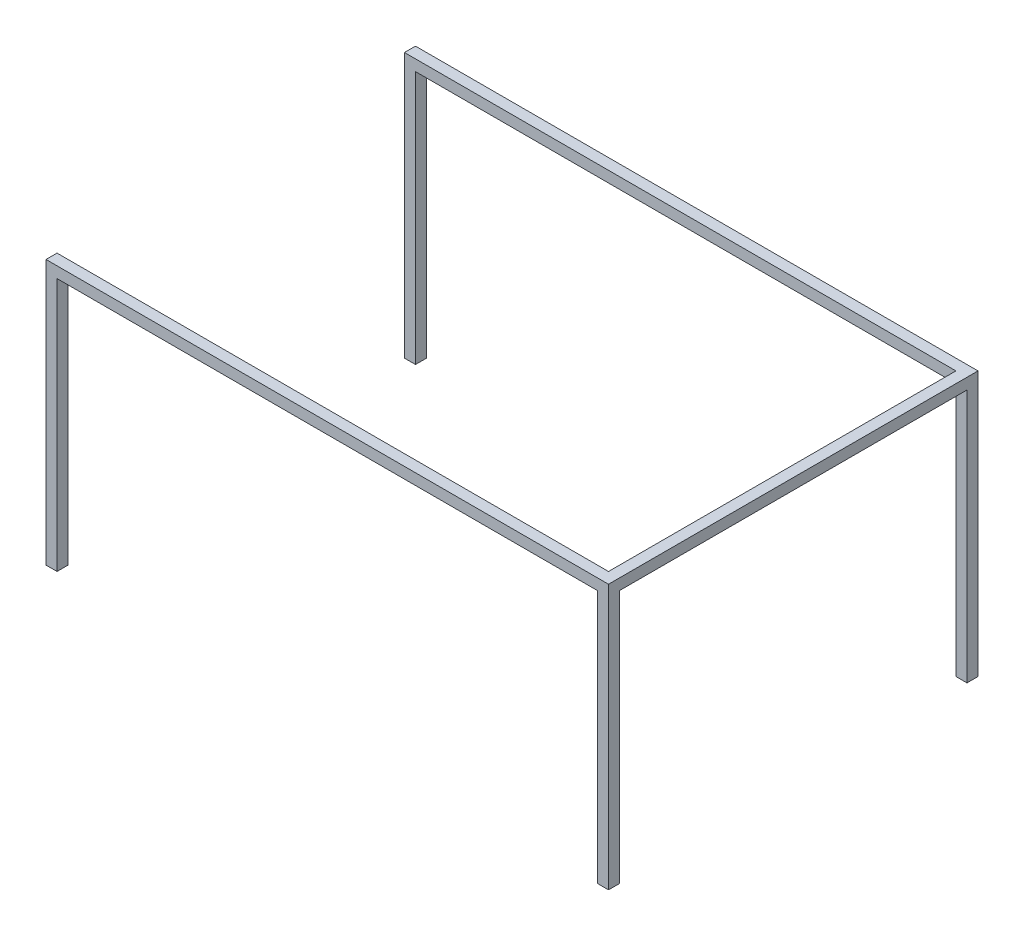
from build123d import *

# Parameters (mm, degrees)
BOSS_EXTRUDE1_DEPTH = 25.4
SKETCH2_W           = 25.4
SKETCH2_H           = 25.4
BOSS_EXTRUDE2_DEPTH = 584.2


with BuildPart() as part:
    # Sketch1 → Boss-Extrude1 (new body)
    with BuildSketch(Plane(origin=(0, 0, 0), x_dir=(1, 0, 0), z_dir=(0, 1, 0))):
        Polygon((-520.7, -425.45), (774.7, -425.45), (774.7, 425.45), (-520.7, 425.45), (-520.7, 400.05), (749.3, 400.05), (749.3, -400.05), (-520.7, -400.05), align=None)
    extrude(amount=BOSS_EXTRUDE1_DEPTH)

    # Sketch2 → Boss-Extrude2 (add)
    with BuildSketch(Plane(origin=(0, 0, 0), x_dir=(1, 0, 0), z_dir=(0, 1, 0))):
        with Locations((-508, 412.75)):
            Rectangle(SKETCH2_W, SKETCH2_H)
        with Locations((762, 412.75)):
            Rectangle(SKETCH2_W, SKETCH2_H)
        with Locations((762, -412.75)):
            Rectangle(SKETCH2_W, SKETCH2_H)
        with Locations((-508, -412.75)):
            Rectangle(SKETCH2_W, SKETCH2_H)
    extrude(amount=-BOSS_EXTRUDE2_DEPTH)


solid = part.part
